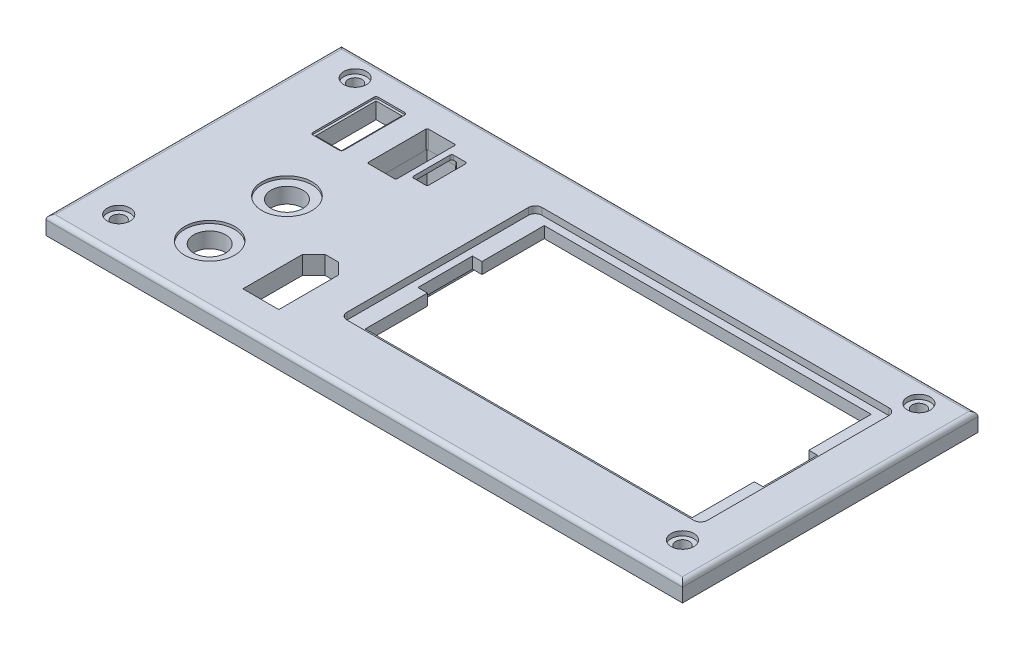
from build123d import *

# Parameters (mm, degrees)
SKETCH_1_W             = 140
SKETCH_1_H             = 65
EXTRUDE_308_DEPTH      = 4
SKETCH_2_W             = 79.3
SKETCH_2_H             = 42.9
CUT_EXTRUDE_543_DEPTH  = 1.5
FILLET_598_R           = 1.5
SKETCH_3_W             = 71.9
SKETCH_3_H             = 39.4
CUT_EXTRUDE_1215_DEPTH = 3
SKETCH_4_W             = 4.2
SKETCH_4_H             = 12
CUT_EXTRUDE_1604_DEPTH = 3
SKETCH_5_R             = 5.5
CUT_EXTRUDE_1906_DEPTH = 0.6
SKETCH_6_R             = 3.5
CUT_EXTRUDE_2046_DEPTH = 88.387413281
SKETCH_7_W             = 6.8
SKETCH_7_H             = 14.4
USB_DEPTH              = 0.4
SKETCH_8_W             = 5.7
SKETCH_8_H             = 13.3
USB_2_DEPTH            = 88.395423221
F_1_USB_R              = 0.5
XT60_DEPTH             = 88.412813706
SKETCH_10_R            = 1.5
CUT_EXTRUDE_4230_DEPTH = 88.412813706
SKETCH_13_R            = 2.5
CUT_EXTRUDE_4744_DEPTH = 1
FILLET_1_R             = 1
CUT_EXTRUDE_1_DEPTH    = 88.412813706
FILLET_2_R             = 0.4
FILLET_3_R             = 0.3
SKETCH_15_W            = 1.3
SKETCH_15_H            = 18.4
EXTRUDE_1_DEPTH        = 1
FILLET_4_R             = 0.3
FILLET_5_R             = 0.4
EXTRUDE_1_2_DEPTH      = 15
FILLET_6_R             = 0.5
SKETCH_18_W            = 1.090661214
SKETCH_18_H            = 18.346721721
CUT_EXTRUDE_2_DEPTH    = 3


with BuildPart() as part:
    # Sketch 1 → Extrude 308 (new body)
    with BuildSketch(Plane(origin=(0, 0, 0), x_dir=(1, 0, 0), z_dir=(0, 1, 0))):
        with Locations((10, -2.5)):
            Rectangle(SKETCH_1_W, SKETCH_1_H)
    extrude(amount=EXTRUDE_308_DEPTH)

    # Sketch 2 → Cut-Extrude 543 (cut)
    with BuildSketch(Plane(origin=(0, 4, 0), x_dir=(1, 0, 0), z_dir=(0, 1, 0))):
        with Locations((31.35, -0.55)):
            Rectangle(SKETCH_2_W, SKETCH_2_H)
    extrude(amount=-CUT_EXTRUDE_543_DEPTH, mode=Mode.SUBTRACT)

    # Fillet 598
    fillet_598_edges = [part.edges().sort_by_distance(p)[0] for p in [
        (71, 3.25, 22),
        (-8.3, 3.25, 22),
        (71, 3.25, -20.9),
        (-8.3, 3.25, -20.9),
    ]]
    fillet(fillet_598_edges, radius=FILLET_598_R)

    # Sketch 3 → Cut-Extrude 1215 (cut)
    with BuildSketch(Plane(origin=(0, 2.5, 0), x_dir=(1, 0, 0), z_dir=(0, 1, 0))):
        with Locations((31.35, -0.5)):
            Rectangle(SKETCH_3_W, SKETCH_3_H)
    extrude(amount=-CUT_EXTRUDE_1215_DEPTH, mode=Mode.SUBTRACT)

    # Sketch 4 → Cut-Extrude 1604 (cut)
    with BuildSketch(Plane(origin=(0, 2.5, 0), x_dir=(1, 0, 0), z_dir=(0, 1, 0))):
        with Locations((-4.6, -0.5)):
            Rectangle(SKETCH_4_W, SKETCH_4_H)
        with Locations((67.1, -0.5)):
            Rectangle(SKETCH_4_W, SKETCH_4_H)
    extrude(amount=-CUT_EXTRUDE_1604_DEPTH, mode=Mode.SUBTRACT)

    # Sketch 5 → Cut-Extrude 1906 (cut)
    with BuildSketch(Plane(origin=(0, 4, 0), x_dir=(1, 0, 0), z_dir=(0, 1, 0))):
        with Locations((-37, -5)):
            Circle(SKETCH_5_R)
        with Locations((-37, -22)):
            Circle(SKETCH_5_R)
    extrude(amount=-CUT_EXTRUDE_1906_DEPTH, mode=Mode.SUBTRACT)

    # Sketch 6 → Cut-Extrude 2046 (cut, through all)
    with BuildSketch(Plane(origin=(0, 3.4, 0), x_dir=(1, 0, 0), z_dir=(0, 1, 0))):
        with Locations((-37, -5)):
            Circle(SKETCH_6_R)
        with Locations((-37, -22)):
            Circle(SKETCH_6_R)
    extrude(amount=-CUT_EXTRUDE_2046_DEPTH, mode=Mode.SUBTRACT)

    # Sketch 7 → USB (cut)
    with BuildSketch(Plane(origin=(0, 4, 0), x_dir=(1, 0, 0), z_dir=(0, 1, 0))):
        with Locations((-42.9, 16.7)):
            Rectangle(SKETCH_7_W, SKETCH_7_H)
    extrude(amount=-USB_DEPTH, mode=Mode.SUBTRACT)

    # Sketch 8 → USB 2 (cut, through all)
    with BuildSketch(Plane(origin=(0, 3.6, 0), x_dir=(1, 0, 0), z_dir=(0, 1, 0))):
        with Locations((-42.9, 16.7)):
            Rectangle(SKETCH_8_W, SKETCH_8_H)
    extrude(amount=-USB_2_DEPTH, mode=Mode.SUBTRACT)

    # 1 USB
    f_1_usb_edges = [part.edges().sort_by_distance(p)[0] for p in [
        (-46.3, 3.8, -9.5),
        (-39.5, 3.8, -9.5),
        (-39.5, 3.8, -23.9),
        (-46.3, 3.8, -23.9),
    ]]
    fillet(f_1_usb_edges, radius=F_1_USB_R)

    # Sketch 9 → XT60 (cut, through all)
    with BuildSketch(Plane(origin=(0, 4, 0), x_dir=(1, 0, 0), z_dir=(0, 1, 0))):
        Polygon((-24.2, -27.5), (-16.3, -27.5), (-16.3, -14.4), (-18.8, -11.9), (-21.7, -11.9), (-24.2, -14.4), align=None)
    extrude(amount=-XT60_DEPTH, mode=Mode.SUBTRACT)

    # Sketch 10 → Cut-Extrude 4230 (cut, through all)
    with BuildSketch(Plane(origin=(0, 4, 0), x_dir=(1, 0, 0), z_dir=(0, 1, 0))):
        with Locations((-52, 25)):
            Circle(SKETCH_10_R)
        with Locations((72, 25)):
            Circle(SKETCH_10_R)
        with Locations((72, -27)):
            Circle(SKETCH_10_R)
        with Locations((-52, -27)):
            Circle(SKETCH_10_R)
    extrude(amount=-CUT_EXTRUDE_4230_DEPTH, mode=Mode.SUBTRACT)

    # Sketch 13 → Cut-Extrude 4744 (cut)
    with BuildSketch(Plane(origin=(0, 4, 0), x_dir=(1, 0, 0), z_dir=(0, 1, 0))):
        with Locations((-52, 25)):
            Circle(SKETCH_13_R)
        with Locations((72, 25)):
            Circle(SKETCH_13_R)
        with Locations((72, -27)):
            Circle(SKETCH_13_R)
        with Locations((-52, -27)):
            Circle(SKETCH_13_R)
    extrude(amount=-CUT_EXTRUDE_4744_DEPTH, mode=Mode.SUBTRACT)

    # Fillet 1
    fillet_1_edges = [part.edges().sort_by_distance(p)[0] for p in [
        (10, 4, 35),
        (80, 4, 2.5),
        (-60, 4, 2.5),
        (10, 4, -30),
    ]]
    fillet(fillet_1_edges, radius=FILLET_1_R)

    # Sketch 14 → Cut-Extrude 1 (cut, through all)
    with BuildSketch(Plane(origin=(0, 4, 0), x_dir=(1, 0, 0), z_dir=(0, 1, 0))):
        Polygon((-28.2, 10.15), (-34.5, 10.15), (-34.5, 23.35), (-28.2, 23.35), (-28.2, 25.9), (-26.9, 25.89999993), (-26.9, 21.14999993), (-23.5, 21.14999993), (-23.5, 12.34999993), (-26.9, 12.34999993), (-26.9, 7.59999993), (-28.2, 7.6), align=None)
    extrude(amount=-CUT_EXTRUDE_1_DEPTH, mode=Mode.SUBTRACT)

    # Fillet 2
    fillet_2_edges = [part.edges().sort_by_distance(p)[0] for p in [
        (-23.5, 2, -12.34999993),
        (-23.5, 2, -21.14999993),
    ]]
    fillet(fillet_2_edges, radius=FILLET_2_R)

    # Fillet 3
    fillet_3_edges = [part.edges().sort_by_distance(p)[0] for p in [
        (-34.5, 2, -10.15),
        (-34.5, 2, -23.35),
    ]]
    fillet(fillet_3_edges, radius=FILLET_3_R)

    # Sketch 15 → Extrude 1 (add)
    with BuildSketch(Plane(origin=(0, 4, 0), x_dir=(1, 0, 0), z_dir=(0, 1, 0))):
        with Locations((-27.55, 16.799999965)):
            Rectangle(SKETCH_15_W, SKETCH_15_H)
    extrude(amount=-EXTRUDE_1_DEPTH)

    # Fillet 4
    fillet_4_edges = [part.edges().sort_by_distance(p)[0] for p in [
        (-28.2, 3.5, -10.15),
        (-28.2, 3.5, -23.35),
    ]]
    fillet(fillet_4_edges, radius=FILLET_4_R)

    # Fillet 5
    fillet_5_edges = [part.edges().sort_by_distance(p)[0] for p in [
        (-26.9, 3.5, -12.34999993),
        (-26.9, 3.5, -21.14999993),
    ]]
    fillet(fillet_5_edges, radius=FILLET_5_R)

    # Sketch 17 → Extrude 1 2 (add)
    with BuildSketch(Plane.XZ):
        Polygon((-36.618386658, -7.996110769), (-30.309338786, -7.996110769), (-30.309338786, -5.553278209), (-23.809338786, -5.553278209), (-23.809338786, -10.1696547), (-21.309338786, -10.1696547), (-21.309338786, -23.245547993), (-23.809338786, -23.245547993), (-23.809338786, -27.954623035), (-30.309338786, -27.954623035), (-30.309338786, -25.408557701), (-36.618386658, -25.408557701), align=None)
        Polygon((-34.618386658, -9.996110769), (-28.309338786, -9.996110769), (-28.309338786, -7.553278209), (-25.809338786, -7.553278209), (-25.809338786, -12.1696547), (-23.309338786, -12.1696547), (-23.309338786, -21.245547993), (-25.809338786, -21.245547993), (-25.809338786, -25.954623035), (-28.309338786, -25.954623035), (-28.309338786, -23.408557701), (-34.618386658, -23.408557701), align=None, mode=Mode.SUBTRACT)
    extrude(amount=EXTRUDE_1_2_DEPTH)

    # Fillet 6
    fillet_6_edges = [part.edges().sort_by_distance(p)[0] for p in [
        (-23.809338786, -7.5, -23.245547993),
        (-23.809338786, -7.5, -27.954623035),
        (-30.309338786, -7.5, -27.954623035),
        (-30.309338786, -7.5, -25.408557701),
        (-36.618386658, -7.5, -25.408557701),
        (-36.618386658, -7.5, -7.996110769),
        (-30.309338786, -7.5, -7.996110769),
        (-30.309338786, -7.5, -5.553278209),
        (-21.309338786, -7.5, -23.245547993),
        (-23.809338786, -7.5, -10.1696547),
        (-21.309338786, -7.5, -10.1696547),
        (-23.809338786, -7.5, -5.553278209),
    ]]
    fillet(fillet_6_edges, radius=FILLET_6_R)

    # Sketch 18 → Cut-Extrude 2 (cut)
    with BuildSketch(Plane.XZ):
        with Locations((-26.354669393, -16.726639069)):
            Rectangle(SKETCH_18_W, SKETCH_18_H)
    extrude(amount=-CUT_EXTRUDE_2_DEPTH, mode=Mode.SUBTRACT)


solid = part.part
